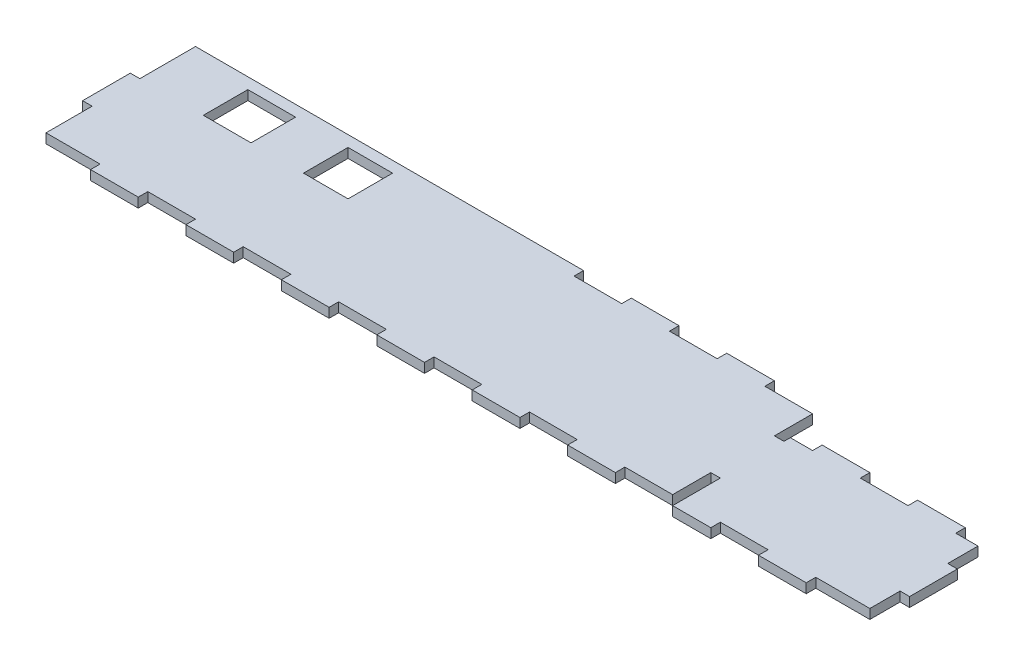
from build123d import *

# Parameters (mm, degrees)
SALIENTE_EXTRUIR1_DEPTH = 3
SKETCH1_W               = 15
SKETCH1_H               = 14
SKETCH1_W_2             = 14
CUT_EXTRUDE1_DEPTH      = 10


with BuildPart() as part:
    # Croquis1 → Saliente-Extruir1 (new body)
    with BuildSketch(Plane(origin=(0, 0, 0), x_dir=(1, 0, 0), z_dir=(0, 1, 0))):
        Polygon((125, 47), (125, 50), (110, 50), (95, 50), (80, 50), (65, 50), (50, 50), (35, 50), (20, 50), (3, 50), (3, 47), (3, 32.5), (0, 32.5), (0, 25), (0, 17.5), (3, 17.5), (3, 3), (20, 3), (20, 0), (35, 0), (35, 3), (50, 3), (50, 0), (65, 0), (65, 3), (80, 3), (80, 0), (95, 0), (95, 3), (110, 3), (110, 0), (125, 0), (125, 3), (140, 3), (140, 0), (155, 0), (155, 3), (170, 3), (170, 0), (185, 0), (185, 3), (197, 3), (200, 3), (200, 15), (203, 15), (203, 0), (215, 0), (215, 3), (230, 3), (230, 0), (245, 0), (245, 3), (262, 3), (262, 12.5), (265, 12.5), (265, 20), (265, 27.5), (262, 27.5), (262, 37), (255, 37), (255, 40), (240, 40), (240, 37), (225, 37), (225, 40), (210, 40), (210, 37), (203, 37), (203, 35), (200, 35), (200, 37), (200, 47), (196.5, 47), (185, 47), (185, 50), (170, 50), (170, 47), (155, 47), (155, 50), (140, 50), (140, 47), align=None)
    extrude(amount=SALIENTE_EXTRUIR1_DEPTH)

    # Sketch1 → Cut-Extrude1 (cut)
    with BuildSketch(Plane(origin=(0, 3, 0), x_dir=(1, 0, 0), z_dir=(0, 1, 0))):
        with Locations((30.46, 39.5)):
            Rectangle(SKETCH1_W, SKETCH1_H)
        with Locations((61.45, 39.5)):
            Rectangle(SKETCH1_W_2, SKETCH1_H)
    extrude(amount=-CUT_EXTRUDE1_DEPTH, mode=Mode.SUBTRACT)


solid = part.part
